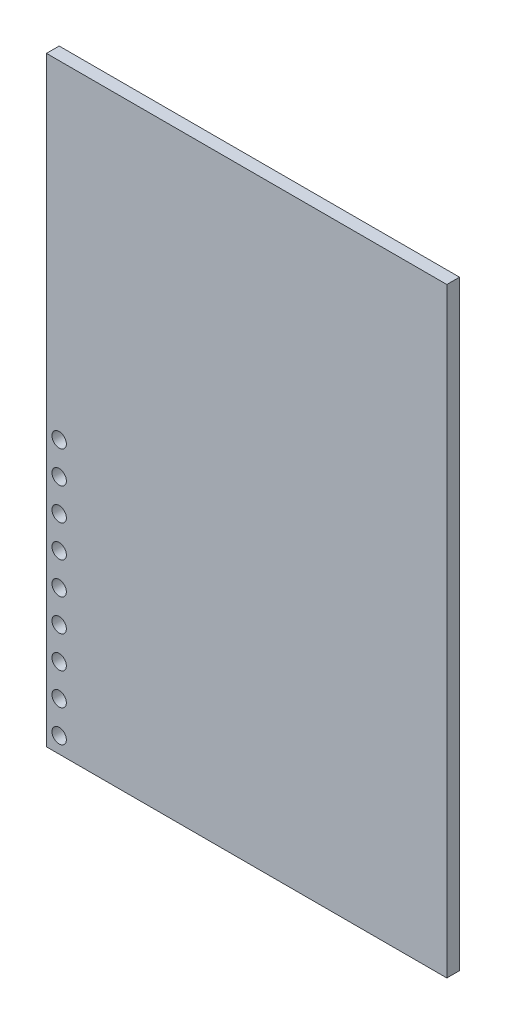
from build123d import *

# Parameters (mm, degrees)
SKETCH1_W           = 100
SKETCH1_H           = 3.175
BOSS_EXTRUDE1_DEPTH = 150
SKETCH2_R           = 1.8
CUT_EXTRUDE2_DEPTH  = 5
SKETCH2_14_R        = 1.8
CUT_EXTRUDE3_DEPTH  = 5
SKETCH2_15_R        = 1.8
CUT_EXTRUDE4_DEPTH  = 5
SKETCH2_16_R        = 1.8
CUT_EXTRUDE5_DEPTH  = 5
SKETCH2_17_R        = 1.8
CUT_EXTRUDE6_DEPTH  = 5
SKETCH2_18_R        = 1.8
CUT_EXTRUDE7_DEPTH  = 5
SKETCH2_19_R        = 1.8
CUT_EXTRUDE8_DEPTH  = 5
SKETCH2_20_R        = 1.8
CUT_EXTRUDE9_DEPTH  = 5
SKETCH2_21_R        = 1.8
CUT_EXTRUDE10_DEPTH = 5


with BuildPart() as part:
    # Sketch1 → Boss-Extrude1 (new body)
    with BuildSketch(Plane(origin=(0, 0, 0), x_dir=(1, 0, 0), z_dir=(0, 1, 0))):
        with Locations((50, 1.5875)):
            Rectangle(SKETCH1_W, SKETCH1_H)
    extrude(amount=BOSS_EXTRUDE1_DEPTH)

    # Sketch2 → Cut-Extrude2 (cut)
    with BuildSketch(Plane.XY):
        with Locations((3.175, 68)):
            Circle(SKETCH2_R)
    extrude(amount=-CUT_EXTRUDE2_DEPTH, mode=Mode.SUBTRACT)

    # Sketch2<14> → Cut-Extrude3 (cut)
    with BuildSketch(Plane.XY):
        with Locations((3.175, 60)):
            Circle(SKETCH2_14_R)
    extrude(amount=-CUT_EXTRUDE3_DEPTH, mode=Mode.SUBTRACT)

    # Sketch2<15> → Cut-Extrude4 (cut)
    with BuildSketch(Plane.XY):
        with Locations((3.175, 52)):
            Circle(SKETCH2_15_R)
    extrude(amount=-CUT_EXTRUDE4_DEPTH, mode=Mode.SUBTRACT)

    # Sketch2<16> → Cut-Extrude5 (cut)
    with BuildSketch(Plane.XY):
        with Locations((3.175, 44)):
            Circle(SKETCH2_16_R)
    extrude(amount=-CUT_EXTRUDE5_DEPTH, mode=Mode.SUBTRACT)

    # Sketch2<17> → Cut-Extrude6 (cut)
    with BuildSketch(Plane.XY):
        with Locations((3.175, 36)):
            Circle(SKETCH2_17_R)
    extrude(amount=-CUT_EXTRUDE6_DEPTH, mode=Mode.SUBTRACT)

    # Sketch2<18> → Cut-Extrude7 (cut)
    with BuildSketch(Plane.XY):
        with Locations((3.175, 28)):
            Circle(SKETCH2_18_R)
    extrude(amount=-CUT_EXTRUDE7_DEPTH, mode=Mode.SUBTRACT)

    # Sketch2<19> → Cut-Extrude8 (cut)
    with BuildSketch(Plane.XY):
        with Locations((3.175, 20)):
            Circle(SKETCH2_19_R)
    extrude(amount=-CUT_EXTRUDE8_DEPTH, mode=Mode.SUBTRACT)

    # Sketch2<20> → Cut-Extrude9 (cut)
    with BuildSketch(Plane.XY):
        with Locations((3.175, 12)):
            Circle(SKETCH2_20_R)
    extrude(amount=-CUT_EXTRUDE9_DEPTH, mode=Mode.SUBTRACT)

    # Sketch2<21> → Cut-Extrude10 (cut)
    with BuildSketch(Plane.XY):
        with Locations((3.175, 4)):
            Circle(SKETCH2_21_R)
    extrude(amount=-CUT_EXTRUDE10_DEPTH, mode=Mode.SUBTRACT)


solid = part.part
